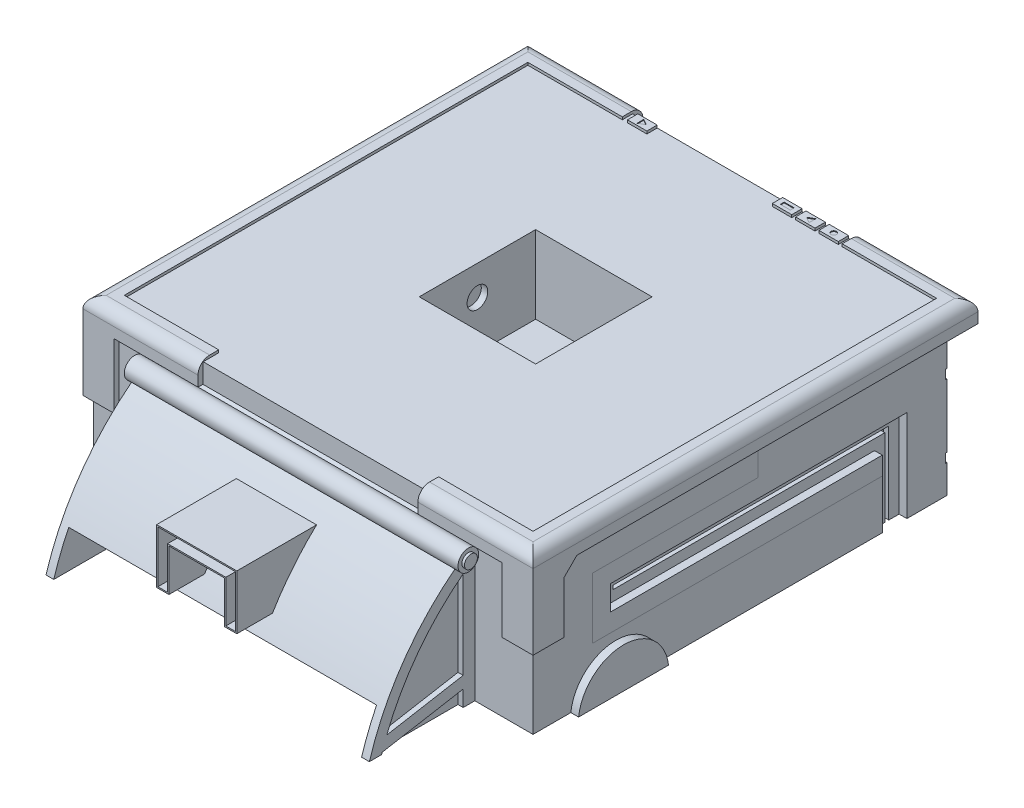
from build123d import *
from build123d.topology import SkipClean

# Parameters (mm, degrees)
SKETCH1_W                  = 340
SKETCH1_H                  = 344
BOSS_EXTRUDE1_DEPTH        = 209
SKETCH2_W                  = 340
SKETCH2_H                  = 344
BOSS_EXTRUDE3_DEPTH        = 133
SKETCH5_W                  = 340
SKETCH5_H                  = 107
CUT_EXTRUDE1_DEPTH         = 24
SKETCH6_W                  = 170
SKETCH6_H                  = 107
BOSS_EXTRUDE4_DEPTH        = 20
SKETCH7_W                  = 340
SKETCH7_H                  = 15
CUT_EXTRUDE2_DEPTH         = 4
CUT_EXTRUDE3_DEPTH         = 170
SKETCH9_W                  = 340
SKETCH9_H                  = 209
CUT_EXTRUDE4_DEPTH         = 4
FILLET1_R                  = 12
BOSS_EXTRUDE5_DEPTH        = 35
CUT_EXTRUDE5_DEPTH         = 8
CUT_EXTRUDE6_DEPTH         = 4
CUT_EXTRUDE9_DEPTH         = 5
SKETCH18_5_W               = 85
SKETCH18_5_H               = 107
BOSS_EXTRUDE6_DEPTH        = 0.8
BOSS_EXTRUDE7_DEPTH        = 170
BOSS_EXTRUDE9_DEPTH        = 107
SKETCH27_W                 = 85
SKETCH27_H                 = 107.8
SKETCH27_W_2               = 73
SKETCH27_H_2               = 50
BOSS_EXTRUDE11_DEPTH       = 0.8
SKETCH29_W                 = 85
SKETCH29_H                 = 102.8
SKETCH29_W_2               = 73
SKETCH29_H_2               = 50
CUT_EXTRUDE10_DEPTH        = 0.4
CUT_EXTRUDE11_DEPTH        = 0.6
CUT_EXTRUDE12_DEPTH        = 2
SKETCH33_W                 = 17
SKETCH33_H                 = 4
BOSS_EXTRUDE12_DEPTH       = 2
SKETCH34_W                 = 26
SKETCH34_H                 = 32
SKETCH34_W_2               = 22
SKETCH34_H_2               = 17
CUT_EXTRUDE13_DEPTH        = 0.4
SKETCH36_W                 = 22
SKETCH36_H                 = 17
CUT_EXTRUDE14_DEPTH        = 0.1
SKETCH37_R                 = 1.8
SKETCH37_R_2               = 1.5
CUT_EXTRUDE18_DEPTH        = 0.5
SKETCH40_R                 = 1.8
SKETCH40_R_2               = 1.5
CUT_EXTRUDE19_DEPTH        = 0.5
SKETCH41_W                 = 72
SKETCH41_H                 = 7
CUT_EXTRUDE20_DEPTH        = 1.2
BOSS_EXTRUDE13_DEPTH       = 8
EXTRUDE_THIN3_START        = -15
EXTRUDE_THIN3_DEPTH        = 15
BOSS_EXTRUDE14_DEPTH       = 2
BOSS_EXTRUDE15_DEPTH       = 50
MIRROR6_COPY_1_DEPTH       = 35
MIRROR6_COPY_2_DEPTH       = 4
MIRROR6_COPY_3_DEPTH       = 35
MIRROR6_COPY_4_DEPTH       = 4
CUT_EXTRUDE21_DEPTH        = 6
CUT_EXTRUDE22_DEPTH        = 4
BOSS_EXTRUDE16_DEPTH       = 6
SKETCH49_R                 = 35
BOSS_EXTRUDE17_DEPTH       = 6
SKETCH51_W                 = 15
SKETCH51_H                 = 8
BOSS_EXTRUDE18_DEPTH       = 2
SKETCH52_R                 = 2.134422377
SKETCH52_W                 = 7.700890096
SKETCH52_H                 = 2.996620518
CUT_EXTRUDE23_DEPTH        = 0.6
BOSS_EXTRUDE19_DEPTH       = 6
CUT_EXTRUDE24_DEPTH        = 4
BOSS_EXTRUDE20_START       = -250
SKETCH57_R                 = 8
BOSS_EXTRUDE20_DEPTH       = 250
BOSS_EXTRUDE21_DEPTH       = 4
SKETCH59_R                 = 5
BOSS_EXTRUDE22_DEPTH       = 2
BOSS_EXTRUDE23_DEPTH       = 238
SKETCH62_W                 = 90
SKETCH62_H                 = 90
CUT_EXTRUDE25_DEPTH        = 60
BOSS_EXTRUDE24_START       = -30
BOSS_EXTRUDE24_DEPTH       = 60
BOSS_EXTRUDE24_2_DEPTH     = 7.5
BOSS_EXTRUDE24_START_2     = 22.5
BOSS_EXTRUDE24_3_DEPTH     = 7.5
BOSS_EXTRUDE25_REACH       = 583.092
BOSS_EXTRUDE25_END_RADIUS  = 193.334535052
BOSS_EXTRUDE26_DEPTH       = 36
CUT_EXTRUDE26_DEPTH        = 238
SKETCH72_W                 = 138.7911761
SKETCH72_H                 = 200
BOSS_EXTRUDE27_DEPTH       = 36
SKETCH73_R                 = 8
BOSS_EXTRUDE28_DEPTH       = 6
SKETCH74_R                 = 12.5
SKETCH74_R_2               = 8
BOSS_EXTRUDE30_DEPTH       = 36
BOSS_EXTRUDE42_START       = -15
BOSS_EXTRUDE42_DEPTH       = 4
BOSS_EXTRUDE43_START       = 213.145262187
BOSS_EXTRUDE43_OUTLINE_W   = 4
BOSS_EXTRUDE43_OUTLINE_H   = 25
BOSS_EXTRUDE43_DEPTH       = 22
SKETCH76_W                 = 25
SKETCH76_H                 = 4
BOSS_EXTRUDE44_DEPTH       = 22
SKETCH77_R                 = 8.5
BOSS_EXTRUDE45_DEPTH       = 20
SKETCH78_R                 = 18
SKETCH78_R_2               = 8.5
BOSS_EXTRUDE48_DEPTH       = 30
SKETCH79_R                 = 16
BOSS_EXTRUDE49_DEPTH       = 65
SKETCH80_R                 = 8.5
BOSS_EXTRUDE51_DEPTH       = 9
BOSS_EXTRUDE53_START       = 11
BOSS_EXTRUDE53_DEPTH       = 4
BOSS_EXTRUDE56_START       = 213.145262187
BOSS_EXTRUDE56_OUTLINE_W   = 4
BOSS_EXTRUDE56_OUTLINE_H   = 25
BOSS_EXTRUDE56_DEPTH       = 22
SKETCH84_W                 = 25
SKETCH84_H                 = 4
BOSS_EXTRUDE57_DEPTH       = 22
MIRROR33_COPY_1_SKETCH_R   = 8
MIRROR33_COPY_1_DEPTH      = 6
MIRROR33_COPY_2_SKETCH_R   = 8
MIRROR33_COPY_2_DEPTH      = 6
MIRROR33_COPY_3_SKETCH_R   = 12.5
MIRROR33_COPY_3_SKETCH_R_2 = 8
MIRROR33_COPY_3_DEPTH      = 36
MIRROR33_COPY_4_SKETCH_R   = 12.5
MIRROR33_COPY_4_SKETCH_R_2 = 8
MIRROR33_COPY_4_DEPTH      = 36
SKETCH85_W                 = 4
SKETCH85_H                 = 202
CUT_EXTRUDE27_DEPTH        = 3
SKETCH86_R                 = 8
CUT_EXTRUDE28_DEPTH        = 5
FILLET2_R                  = 9
BOSS_EXTRUDE58_DEPTH       = 4
MIRROR37_COPY_1_SKETCH_R   = 8
MIRROR37_COPY_1_DEPTH      = 5
MIRROR37_COPY_2_SKETCH_R   = 8
MIRROR37_COPY_2_DEPTH      = 5
BOSS_EXTRUDE59_DEPTH       = 4
CUT_EXTRUDE29_DEPTH        = 40
SKETCH90_R                 = 10
CUT_EXTRUDE30_DEPTH        = 15
MIRROR39_COPY_1_SKETCH_R   = 10
MIRROR39_COPY_1_DEPTH      = 15
FILLET4_R                  = 12
SKETCH92_W                 = 364.21119794
SKETCH92_H                 = 456.773159848
CUT_EXTRUDE31_DEPTH        = 220
SKETCH93_W                 = 280
SKETCH93_H                 = 280
SKETCH93_W_2               = 260
SKETCH93_H_2               = 260
BOSS_EXTRUDE60_DEPTH       = 10
SKETCH94_R                 = 15
CUT_EXTRUDE32_DEPTH        = 62


with BuildPart() as part:
    # Sketch1 → Boss-Extrude1 (new body)
    with BuildSketch(Plane(origin=(0, 0, 0), x_dir=(1, 0, 0), z_dir=(0, 1, 0))):
        Rectangle(SKETCH1_W, SKETCH1_H)
    extrude(amount=BOSS_EXTRUDE1_DEPTH)

    # Sketch2 → Boss-Extrude3 (add)
    with BuildSketch(Plane(origin=(0, 209, 0), x_dir=(1, 0, 0), z_dir=(0, 1, 0))):
        Rectangle(SKETCH2_W, SKETCH2_H)
    extrude(amount=BOSS_EXTRUDE3_DEPTH)

    # Sketch5 → Cut-Extrude1 (cut)
    with BuildSketch(Plane(origin=(0, 0, -172), x_dir=(-1, 0, 0), z_dir=(0, 0, -1))):
        with Locations((0, 273.5)):
            Rectangle(SKETCH5_W, SKETCH5_H)
    extrude(amount=-CUT_EXTRUDE1_DEPTH, mode=Mode.SUBTRACT)

    # Sketch6 → Boss-Extrude4 (add)
    with BuildSketch(Plane(origin=(0, 0, -148), x_dir=(-1, 0, 0), z_dir=(0, 0, -1))):
        with Locations((0, 273.5)):
            Rectangle(SKETCH6_W, SKETCH6_H)
    extrude(amount=BOSS_EXTRUDE4_DEPTH)

    # Sketch7 → Cut-Extrude2 (cut)
    with BuildSketch(Plane(origin=(0, 0, -172), x_dir=(-1, 0, 0), z_dir=(0, 0, -1))):
        with Locations((0, 334.5)):
            Rectangle(SKETCH7_W, SKETCH7_H)
    extrude(amount=-CUT_EXTRUDE2_DEPTH, mode=Mode.SUBTRACT)

    # Sketch8 → Cut-Extrude3 (cut)
    with BuildSketch(Plane.ZY.offset(85)):
        Polygon((-168, 327), (-160, 342), (-168, 342), align=None)
    extrude(amount=-CUT_EXTRUDE3_DEPTH, mode=Mode.SUBTRACT)

    # Sketch9 → Cut-Extrude4 (cut)
    with BuildSketch(Plane(origin=(0, 0, -172), x_dir=(-1, 0, 0), z_dir=(0, 0, -1))):
        with Locations((0, 104.5)):
            Rectangle(SKETCH9_W, SKETCH9_H)
    extrude(amount=-CUT_EXTRUDE4_DEPTH, mode=Mode.SUBTRACT)

    # Fillet1
    fillet1_edges = [part.edges().sort_by_distance(p)[0] for p in [
        (-170, 104.5, -168),
        (170, 104.5, -168),
    ]]
    fillet(fillet1_edges, radius=FILLET1_R)

    # Sketch13 → Boss-Extrude5 (add)
    with BuildSketch(Plane(origin=(-158, 0, 0), x_dir=(0, 0, -1), z_dir=(1, 0, 0))):
        Polygon((172, 209), (167.854423693, 209), (168, 89), (172, 172), align=None)
    boss_extrude5 = extrude(amount=BOSS_EXTRUDE5_DEPTH)

    # Sketch14 → Cut-Extrude5 (cut)
    with BuildSketch(Plane(origin=(-84, 0, 0), x_dir=(0, 0, -1), z_dir=(1, 0, 0))):
        Polygon((168, 195), (164, 195), (164, 92), (168, 85), align=None)
    cut_extrude5 = extrude(amount=CUT_EXTRUDE5_DEPTH, mode=Mode.SUBTRACT)

    # Sketch16 → Cut-Extrude6 (cut)
    with BuildSketch(Plane(origin=(0, 0, 0), x_dir=(0, 0, -1), z_dir=(1, 0, 0))):
        Polygon((168, 195), (164, 195), (164, 92), (168, 85), align=None)
    cut_extrude6 = extrude(amount=-CUT_EXTRUDE6_DEPTH, mode=Mode.SUBTRACT)

    # Sketch18 → Cut-Extrude9 (cut)
    with BuildSketch(Plane(origin=(0, 0, -168), x_dir=(-1, 0, 0), z_dir=(0, 0, -1))):
        Polygon((4, 319.5), (4, 230), (12.5, 230), (12.5, 222.5), (72.5, 222.5), (72.5, 230), (81, 230), (81, 319.5), (72.5, 319.5), (72.5, 324.5), (12.5, 324.5), (12.5, 319.5), align=None)
    extrude(amount=-CUT_EXTRUDE9_DEPTH, mode=Mode.SUBTRACT)

    # Sketch18<5> → Boss-Extrude6 (add)
    with BuildSketch(Plane(origin=(0, 0, -168), x_dir=(-1, 0, 0), z_dir=(0, 0, -1))):
        with Locations((42.5, 273.5)):
            Rectangle(SKETCH18_5_W, SKETCH18_5_H)
        Polygon((4, 319.5), (4, 230), (12.5, 230), (12.5, 222.5), (72.5, 222.5), (72.5, 230), (81, 230), (81, 319.5), (72.5, 319.5), (72.5, 324.5), (12.5, 324.5), (12.5, 319.5), align=None, mode=Mode.SUBTRACT)
    extrude(amount=BOSS_EXTRUDE6_DEPTH)

    # Sketch22 → Boss-Extrude7 (add)
    with BuildSketch(Plane.ZY.offset(85)):
        Polygon((-168, 327), (-160, 342), (-168, 327.8), align=None)
    extrude(amount=-BOSS_EXTRUDE7_DEPTH)

    # Sketch25 → Boss-Extrude9 (add)
    with BuildSketch(Plane(origin=(0, 220, 0), x_dir=(1, 0, 0), z_dir=(0, 1, 0))):
        with BuildLine():
            Line((-85, 168.8), (-85, 148))
            Line((-85, 148), (-90, 148))
            Line((-90, 148), (-90, 163.8))
            ThreePointArc((-90, 163.8), (-88.535533906, 167.335533906), (-85, 168.8))
        make_face()
    boss_extrude9 = extrude(amount=BOSS_EXTRUDE9_DEPTH)

    # Mirror1: Boss-Extrude9 across plane
    add(boss_extrude9.mirror(Plane(origin=(0, 0, 0), x_dir=(0, 0, 1), z_dir=(1, 0, 0))))

    # Sketch27 → Boss-Extrude11 (add)
    with BuildSketch(Plane(origin=(0, 0, -168), x_dir=(-1, 0, 0), z_dir=(0, 0, -1))):
        with Locations((-42.5, 273.9)):
            Rectangle(SKETCH27_W, SKETCH27_H)
        with Locations((-42.5, 294.8)):
            Rectangle(SKETCH27_W_2, SKETCH27_H_2, mode=Mode.SUBTRACT)
    extrude(amount=BOSS_EXTRUDE11_DEPTH)

    # Sketch29 → Cut-Extrude10 (cut)
    with BuildSketch(Plane(origin=(0, 0, -168.8), x_dir=(-1, 0, 0), z_dir=(0, 0, -1))):
        with Locations((-40.5, 274.4)):
            Rectangle(SKETCH29_W, SKETCH29_H)
        with Locations((-42.5, 294.8)):
            Rectangle(SKETCH29_W_2, SKETCH29_H_2, mode=Mode.SUBTRACT)
    extrude(amount=-CUT_EXTRUDE10_DEPTH, mode=Mode.SUBTRACT)

    # Sketch31 → Cut-Extrude11 (cut)
    with BuildSketch(Plane(origin=(0, 0, -168), x_dir=(-1, 0, 0), z_dir=(0, 0, -1))):
        with BuildLine():
            Line((-62, 313.3), (-23, 313.3))
            ThreePointArc((-23, 313.3), (-16.636038969, 310.663961031), (-14, 304.3))
            Line((-14, 304.3), (-14, 285.3))
            ThreePointArc((-14, 285.3), (-16.636038969, 278.936038969), (-23, 276.3))
            Line((-23, 276.3), (-62, 276.3))
            ThreePointArc((-62, 276.3), (-68.363961031, 278.936038969), (-71, 285.3))
            Line((-71, 285.3), (-71, 304.3))
            ThreePointArc((-71, 304.3), (-68.363961031, 310.663961031), (-62, 313.3))
        make_face()
    extrude(amount=-CUT_EXTRUDE11_DEPTH, mode=Mode.SUBTRACT)

    # Sketch32 → Cut-Extrude12 (cut)
    with BuildSketch(Plane(origin=(0, 0, -167.4), x_dir=(-1, 0, 0), z_dir=(0, 0, -1))):
        Polygon((-53, 313.3), (-53, 304.3), (-71, 304.3), (-71, 302.3), (-53, 302.3), (-53, 298.3), (-71, 298.3), (-71, 296.3), (-53, 296.3), (-53, 292.3), (-71, 292.3), (-71, 290.3), (-53, 290.3), (-53, 286.3), (-71, 286.3), (-71, 284.3), (-53, 284.3), (-53, 276.3), (-51, 276.3), (-51, 284.3), (-34, 284.3), (-34, 276.3), (-32, 276.3), (-32, 284.3), (-14, 284.3), (-14, 286.3), (-32, 286.3), (-32, 290.3), (-14, 290.3), (-14, 292.3), (-32, 292.3), (-32, 296.3), (-14, 296.3), (-14, 298.3), (-32, 298.3), (-32, 302.3), (-14, 302.3), (-14, 304.3), (-32, 304.3), (-32, 313.3), (-34, 313.3), (-34, 304.3), (-51, 304.3), (-51, 313.3), align=None)
    extrude(amount=-CUT_EXTRUDE12_DEPTH, mode=Mode.SUBTRACT)

    # Sketch33 → Boss-Extrude12 (add)
    with BuildSketch(Plane(origin=(0, 0, -165.4), x_dir=(-1, 0, 0), z_dir=(0, 0, -1))):
        with Locations((-42.5, 294.3)):
            Rectangle(SKETCH33_W, SKETCH33_H)
        with Locations((-42.5, 300.3)):
            Rectangle(SKETCH33_W, SKETCH33_H)
        with Locations((-42.5, 288.3)):
            Rectangle(SKETCH33_W, SKETCH33_H)
    extrude(amount=BOSS_EXTRUDE12_DEPTH)

    # Sketch34 → Cut-Extrude13 (cut)
    with BuildSketch(Plane(origin=(0, 0, -168.4), x_dir=(-1, 0, 0), z_dir=(0, 0, -1))):
        with Locations((-62, 247)):
            Rectangle(SKETCH34_W, SKETCH34_H)
        with Locations((-62, 249.5)):
            Rectangle(SKETCH34_W_2, SKETCH34_H_2, mode=Mode.SUBTRACT)
    extrude(amount=-CUT_EXTRUDE13_DEPTH, mode=Mode.SUBTRACT)

    # Sketch36 → Cut-Extrude14 (cut)
    with BuildSketch(Plane(origin=(0, 0, -168.4), x_dir=(-1, 0, 0), z_dir=(0, 0, -1))):
        with Locations((-62, 249.5)):
            Rectangle(SKETCH36_W, SKETCH36_H)
    extrude(amount=-CUT_EXTRUDE14_DEPTH, mode=Mode.SUBTRACT)

    # Sketch37 → Cut-Extrude18 (cut)
    # profile 1 of 4: a face of its own
    with BuildSketch(Plane(origin=(0, 0, -168.4), x_dir=(-1, 0, 0), z_dir=(0, 0, -1))):
        with Locations((-0.6, 225.6)):
            Circle(SKETCH37_R)
        with Locations((-0.6, 225.6)):
            Circle(SKETCH37_R_2, mode=Mode.SUBTRACT)
    # profile 2 of 4: a face of its own
    with BuildSketch(Plane(origin=(0, 0, -168.4), x_dir=(-1, 0, 0), z_dir=(0, 0, -1))):
        with Locations((-80.4, 225.6)):
            Circle(SKETCH37_R)
        with Locations((-80.4, 225.6)):
            Circle(SKETCH37_R_2, mode=Mode.SUBTRACT)
    # profile 3 of 4: a face of its own
    with BuildSketch(Plane(origin=(0, 0, -168.4), x_dir=(-1, 0, 0), z_dir=(0, 0, -1))):
        with Locations((-80.4, 323.2)):
            Circle(SKETCH37_R)
        with Locations((-80.4, 323.2)):
            Circle(SKETCH37_R_2, mode=Mode.SUBTRACT)
    # profile 4 of 4: a face of its own
    with BuildSketch(Plane(origin=(0, 0, -168.4), x_dir=(-1, 0, 0), z_dir=(0, 0, -1))):
        with Locations((-0.6, 323.2)):
            Circle(SKETCH37_R)
        with Locations((-0.6, 323.2)):
            Circle(SKETCH37_R_2, mode=Mode.SUBTRACT)
    extrude(amount=-CUT_EXTRUDE18_DEPTH, mode=Mode.SUBTRACT)

    # Sketch40 → Cut-Extrude19 (cut)
    # profile 1 of 4: a face of its own
    with BuildSketch(Plane(origin=(0, 0, -168.8), x_dir=(-1, 0, 0), z_dir=(0, 0, -1))):
        with Locations((9.5, 322.5)):
            Circle(SKETCH40_R)
        with Locations((9.5, 322.5)):
            Circle(SKETCH40_R_2, mode=Mode.SUBTRACT)
    # profile 2 of 4: a face of its own
    with BuildSketch(Plane(origin=(0, 0, -168.8), x_dir=(-1, 0, 0), z_dir=(0, 0, -1))):
        with Locations(Location((75.5, 322.5, 0), (0, 0, 180))):
            Circle(SKETCH40_R)
        with Locations(Location((75.5, 322.5, 0), (0, 0, 180))):
            Circle(SKETCH40_R_2, mode=Mode.SUBTRACT)
    # profile 3 of 4: a face of its own
    with BuildSketch(Plane(origin=(0, 0, -168.8), x_dir=(-1, 0, 0), z_dir=(0, 0, -1))):
        with Locations((75.5, 227)):
            Circle(SKETCH40_R)
        with Locations((75.5, 227)):
            Circle(SKETCH40_R_2, mode=Mode.SUBTRACT)
    # profile 4 of 4: a face of its own
    with BuildSketch(Plane(origin=(0, 0, -168.8), x_dir=(-1, 0, 0), z_dir=(0, 0, -1))):
        with Locations(Location((9.5, 227, 0), (0, 0, 180))):
            Circle(SKETCH40_R)
        with Locations(Location((9.5, 227, 0), (0, 0, 180))):
            Circle(SKETCH40_R_2, mode=Mode.SUBTRACT)
    extrude(amount=-CUT_EXTRUDE19_DEPTH, mode=Mode.SUBTRACT)

    # Sketch41 → Cut-Extrude20 (cut)
    with BuildSketch(Plane(origin=(0, 0, -148), x_dir=(-1, 0, 0), z_dir=(0, 0, -1))):
        with Locations((134, 301.5)):
            Rectangle(SKETCH41_W, SKETCH41_H)
        with Locations((134, 245.5)):
            Rectangle(SKETCH41_W, SKETCH41_H)
    cut_extrude20 = extrude(amount=-CUT_EXTRUDE20_DEPTH, mode=Mode.SUBTRACT)

    # Sketch42 → Boss-Extrude13 (add)
    with BuildSketch(Plane.ZY.offset(90)):
        Polygon((-148, 327), (-148, 220), (-152, 220), (-152, 242), (-154.5, 242), (-154.5, 249), (-152, 249), (-152, 298), (-153.572455971, 298), (-153.572455971, 305), (-152, 305), (-152, 327), align=None)
    boss_extrude13 = extrude(amount=BOSS_EXTRUDE13_DEPTH)

    # Mirror2: Cut-Extrude20, Boss-Extrude13 across plane
    add(cut_extrude20.mirror(Plane(origin=(0, 0, 0), x_dir=(0, 0, 1), z_dir=(1, 0, 0))), mode=Mode.SUBTRACT)
    add(boss_extrude13.mirror(Plane(origin=(0, 0, 0), x_dir=(0, 0, 1), z_dir=(1, 0, 0))))

    # Sketch43 → Extrude-Thin3 (add)
    with BuildSketch(Plane(origin=(0, 342, 0), x_dir=(1, 0, 0), z_dir=(0, 1, 0)).offset(EXTRUDE_THIN3_START)):
        Polygon((-174, 168), (-174, -176), (-85, -176), (-85, -160), (-95, -160), (-95, -166), (-164, -166), (-164, 168), align=None)
    extrude_thin3 = extrude(amount=EXTRUDE_THIN3_DEPTH)

    # Mirror3: Extrude-Thin3 across plane
    add(extrude_thin3.mirror(Plane(origin=(0, 0, 0), x_dir=(0, 0, 1), z_dir=(1, 0, 0))))

    # Sketch43<6> → Boss-Extrude14 (add)
    with BuildSketch(Plane(origin=(0, 342, 0), x_dir=(1, 0, 0), z_dir=(0, 1, 0))):
        Polygon((85, 160), (85, 152), (158, 152), (158, -160), (85, -160), (85, -172), (170, -172), (170, 168), (85, 168), align=None)
        Polygon((170, -172), (85, -172), (85, -176), (174, -176), (174, 168), (170, 168), align=None)
        Polygon((-158, -160), (-158, 152), (-85, 152), (-85, 160), (-85, 168), (-170, 168), (-170, -172), (-85, -172), (-85, -160), align=None)
        Polygon((-85, -176), (-85, -172), (-170, -172), (-170, 168), (-174, 168), (-174, -176), align=None)
    extrude(amount=BOSS_EXTRUDE14_DEPTH)

    # Sketch44 → Boss-Extrude15 (add)
    with BuildSketch(Plane.XZ.offset(-327)):
        Polygon((-150, 176), (-174, 176), (-174, 152), (-170, 152), (-170, 172), (-150, 172), align=None)
    boss_extrude15 = extrude(amount=BOSS_EXTRUDE15_DEPTH)

    # Mirror4: Boss-Extrude15 across plane
    add(boss_extrude15.mirror(Plane(origin=(0, 0, 0), x_dir=(0, 0, 1), z_dir=(1, 0, 0))))

    # Mirror5: Boss-Extrude5, Cut-Extrude6 across plane
    add(boss_extrude5.mirror(Plane(origin=(0, 0, 0), x_dir=(0, 0, 1), z_dir=(1, 0, 0))))
    add(cut_extrude6.mirror(Plane(origin=(0, 0, 0), x_dir=(0, 0, 1), z_dir=(1, 0, 0))), mode=Mode.SUBTRACT)

    # Mirror6: Cut-Extrude5 across plane
    add(cut_extrude5.mirror(Plane(origin=(0, 0, 0), x_dir=(0, 0, 1), z_dir=(1, 0, 0))), mode=Mode.SUBTRACT)

    # Mirror6 copy 1 sketch → Mirror6 copy 1 (add)
    with BuildSketch(Plane(origin=(-158, 0, 0), x_dir=(0, 0, -1), z_dir=(1, 0, 0))):
        Polygon((172, 209), (167.854423693, 209), (168, 89), (172, 172), align=None)
    extrude(amount=MIRROR6_COPY_1_DEPTH)

    # Mirror6 copy 2 sketch → Mirror6 copy 2 (cut)
    with BuildSketch(Plane(origin=(0, 0, 0), x_dir=(0, 0, -1), z_dir=(1, 0, 0))):
        Polygon((168, 195), (164, 195), (164, 92), (168, 85), align=None)
    extrude(amount=-MIRROR6_COPY_2_DEPTH, mode=Mode.SUBTRACT)

    # Mirror6 copy 3 sketch → Mirror6 copy 3 (add)
    with BuildSketch(Plane(origin=(158, 0, 0), x_dir=(0, 0, -1), z_dir=(-1, 0, 0))):
        Polygon((172, -209), (167.854423693, -209), (168, -89), (172, -172), align=None)
    extrude(amount=MIRROR6_COPY_3_DEPTH)

    # Mirror6 copy 4 sketch → Mirror6 copy 4 (cut)
    with BuildSketch(Plane(origin=(0, 0, 0), x_dir=(0, 0, -1), z_dir=(-1, 0, 0))):
        Polygon((168, -195), (164, -195), (164, -92), (168, -85), align=None)
    extrude(amount=-MIRROR6_COPY_4_DEPTH, mode=Mode.SUBTRACT)

    # Sketch46 → Cut-Extrude21 (cut)
    with BuildSketch(Plane.ZY.offset(170)):
        Polygon((-117, 291), (112, 291), (112, 272), (-98, 272), (-98, 81), (91.671025307, 81), (91.671025307, 62), (-117, 62), align=None)
    cut_extrude21 = extrude(amount=-CUT_EXTRUDE21_DEPTH, mode=Mode.SUBTRACT)

    # Sketch47 → Cut-Extrude22 (cut)
    with BuildSketch(Plane.ZY.offset(164)):
        Polygon((-109, 283), (-109, 70), (83.671025307, 70), (83.671025307, 73), (-106, 73), (-106, 280), (104, 280), (104, 283), align=None)
    cut_extrude22 = extrude(amount=-CUT_EXTRUDE22_DEPTH, mode=Mode.SUBTRACT)

    # Sketch48 → Boss-Extrude16 (add)
    with BuildSketch(Plane.ZY.offset(170)):
        Polygon((-98, 81), (-98, 213), (172, 166), (172, 81), align=None)
    boss_extrude16 = extrude(amount=BOSS_EXTRUDE16_DEPTH)

    # Sketch49 → Boss-Extrude17 (add)
    with BuildSketch(Plane.ZY.offset(170)):
        with Locations(Location((108, 216, 0), (0, 0, 191.536959033))):
            Circle(SKETCH49_R)
    boss_extrude17 = extrude(amount=BOSS_EXTRUDE17_DEPTH)

    # Sketch51 → Boss-Extrude18 (add)
    with BuildSketch(Plane(origin=(0, 342, 0), x_dir=(1, 0, 0), z_dir=(0, 1, 0))):
        with Locations((-73.5, 156)):
            Rectangle(SKETCH51_W, SKETCH51_H)
        with Locations((74.5, 156)):
            Rectangle(SKETCH51_W, SKETCH51_H)
        with Locations((56.5, 156)):
            Rectangle(SKETCH51_W, SKETCH51_H)
        with Locations((38.5, 156)):
            Rectangle(SKETCH51_W, SKETCH51_H)
    extrude(amount=BOSS_EXTRUDE18_DEPTH)

    # Sketch52 → Cut-Extrude23 (cut)
    with BuildSketch(Plane(origin=(0, 344, 0), x_dir=(1, 0, 0), z_dir=(0, 1, 0))):
        with Locations(Location((74.5, 156, 0), (0, 0, 270))):
            Circle(SKETCH52_R)
        Polygon((53.437575423, 156), (58.031212288, 153.34786252), (58.031212288, 158.65213748), align=None)
        with Locations((38.5, 156)):
            Rectangle(SKETCH52_W, SKETCH52_H)
        Polygon((-70.500703421, 156), (-74.999648289, 158.597467031), (-74.999648289, 153.402532969), align=None)
    extrude(amount=-CUT_EXTRUDE23_DEPTH, mode=Mode.SUBTRACT)

    # Mirror7: Cut-Extrude21, Cut-Extrude22, Boss-Extrude16, Boss-Extrude17 across plane
    add(cut_extrude21.mirror(Plane(origin=(0, 0, 0), x_dir=(0, 0, 1), z_dir=(1, 0, 0))), mode=Mode.SUBTRACT)
    add(cut_extrude22.mirror(Plane(origin=(0, 0, 0), x_dir=(0, 0, 1), z_dir=(1, 0, 0))), mode=Mode.SUBTRACT)
    add(boss_extrude16.mirror(Plane(origin=(0, 0, 0), x_dir=(0, 0, 1), z_dir=(1, 0, 0))))
    add(boss_extrude17.mirror(Plane(origin=(0, 0, 0), x_dir=(0, 0, 1), z_dir=(1, 0, 0))))

    # Sketch55 → Boss-Extrude19 (add)
    with BuildSketch(Plane.ZY.offset(125)):
        with BuildLine():
            Line((172, 0), (172, 326.804016556))
            ThreePointArc((172, 326.804016556), (262, 163.402008278), (172, 0))
        make_face()
    boss_extrude19 = extrude(amount=-BOSS_EXTRUDE19_DEPTH)

    # Sketch56 → Cut-Extrude24 (cut)
    with BuildSketch(Plane.ZY.offset(125)):
        with BuildLine():
            Line((181, 241.553207546), (240.106366627, 231.131160378))
            ThreePointArc((240.106366627, 231.131160378), (215.871541567, 274.350608176), (181, 309.553207546))
            Line((181, 309.553207546), (181, 241.553207546))
        make_face()
        with BuildLine():
            Line((243.648898663, 221.367676893), (181, 232.414368039))
            Line((181, 232.414368039), (181, 209))
            Line((181, 209), (181, 89.25080901))
            Line((181, 89.25080901), (252.987298561, 161.238107571))
            ThreePointArc((252.987298561, 161.238107571), (250.816391543, 191.690888666), (243.648898663, 221.367676893))
        make_face()
        with BuildLine():
            Line((181, 80.576479256), (252.661628315, 152.238107571))
            ThreePointArc((252.661628315, 152.238107571), (231.47935686, 76.967886467), (181, 17.25080901))
            Line((181, 17.25080901), (181, 80.576479256))
        make_face()
    cut_extrude24 = extrude(amount=-CUT_EXTRUDE24_DEPTH, mode=Mode.SUBTRACT)

    # Mirror8: Boss-Extrude19, Cut-Extrude24 across plane
    add(boss_extrude19.mirror(Plane(origin=(0, 0, 0), x_dir=(0, 0, 1), z_dir=(1, 0, 0))))
    add(cut_extrude24.mirror(Plane(origin=(0, 0, 0), x_dir=(0, 0, 1), z_dir=(1, 0, 0))), mode=Mode.SUBTRACT)

    # Sketch57 → Boss-Extrude20 (add)
    with BuildSketch(Plane.ZY.offset(125).offset(BOSS_EXTRUDE20_START)):
        with Locations(Location((181, 320.752555397, 0), (0, 0, 323.290973946))):
            Circle(SKETCH57_R)
    extrude(amount=BOSS_EXTRUDE20_DEPTH)

    # Sketch58 → Boss-Extrude21 (add)
    with BuildSketch(Plane.ZY.offset(125)):
        with BuildLine():
            ThreePointArc((189, 320.752555397), (183.361529997, 328.39606088), (174.394205982, 325.265147267))
            ThreePointArc((174.394205982, 325.265147267), (176.351703304, 314.241538745), (187.413451902, 315.970543822))
            ThreePointArc((187.413451902, 315.970543822), (188.593010444, 318.233390378), (189, 320.752555397))
        make_face()
    boss_extrude21 = extrude(amount=BOSS_EXTRUDE21_DEPTH)

    # Sketch59 → Boss-Extrude22 (add)
    with BuildSketch(Plane.ZY.offset(129)):
        with Locations((181, 320.752555397)):
            Circle(SKETCH59_R)
    boss_extrude22 = extrude(amount=BOSS_EXTRUDE22_DEPTH)

    # Mirror9: Boss-Extrude21, Boss-Extrude22 across plane
    add(boss_extrude21.mirror(Plane(origin=(0, 0, 0), x_dir=(0, 0, 1), z_dir=(1, 0, 0))))
    add(boss_extrude22.mirror(Plane(origin=(0, 0, 0), x_dir=(0, 0, 1), z_dir=(1, 0, 0))))

    # Sketch61 → Boss-Extrude23 (add)
    with BuildSketch(Plane.ZY.offset(-119)):
        with BuildLine():
            Line((172, 326.804016556), (172, 232.208396297))
            Line((172, 232.208396297), (249.341759496, 232.208396297))
            ThreePointArc((249.341759496, 232.208396297), (218.340515226, 285.776931233), (172, 326.804016556))
        make_face()
    extrude(amount=BOSS_EXTRUDE23_DEPTH)

    # Sketch62 → Cut-Extrude25 (cut)
    with BuildSketch(Plane(origin=(0, 342, 0), x_dir=(1, 0, 0), z_dir=(0, 1, 0))):
        Rectangle(SKETCH62_W, SKETCH62_H)
    extrude(amount=-CUT_EXTRUDE25_DEPTH, mode=Mode.SUBTRACT)

    # Boss-Extrude24: read off the stored shape, not the designer's step
    # Boss-Extrude24 outline → Boss-Extrude24 (add)
    with BuildSketch(Plane.YZ.offset(BOSS_EXTRUDE24_START)):
        with BuildLine():
            Line((303.970543822, 201.401026343), (303.970543822, 207.162416319))
            ThreePointArc((303.970543822, 207.162416319), (300.268172507, 210.82232132), (296.470543822, 214.383286687))
            Line((296.470543822, 214.383286687), (296.470543822, 208.91883315))
            ThreePointArc((296.470543822, 208.91883315), (300.272169464, 205.211433107), (303.970543822, 201.401026343))
        make_face()
    extrude(amount=BOSS_EXTRUDE24_DEPTH)

    # Boss-Extrude24 2 outline → Boss-Extrude24 2 (add)
    with BuildSketch(Plane.YZ.offset(BOSS_EXTRUDE24_START)):
        with BuildLine():
            Line((296.470543822, 208.91883315), (296.470543822, 214.383286687))
            ThreePointArc((296.470543822, 214.383286687), (280.796665928, 227.282655314), (263.880543822, 238.503572036))
            Line((263.880543822, 238.503572036), (263.880543822, 233.839029233))
            ThreePointArc((263.880543822, 233.839029233), (280.83842787, 222.245834127), (296.470543822, 208.91883315))
        make_face()
    extrude(amount=BOSS_EXTRUDE24_2_DEPTH)

    # Boss-Extrude24 3 outline → Boss-Extrude24 3 (add)
    with BuildSketch(Plane.YZ.offset(BOSS_EXTRUDE24_START_2)):
        with BuildLine():
            Line((296.470543822, 208.91883315), (296.470543822, 214.383286687))
            ThreePointArc((296.470543822, 214.383286687), (280.796665928, 227.282655314), (263.880543822, 238.503572036))
            Line((263.880543822, 238.503572036), (263.880543822, 233.839029233))
            ThreePointArc((263.880543822, 233.839029233), (280.83842787, 222.245834127), (296.470543822, 208.91883315))
        make_face()
    extrude(amount=BOSS_EXTRUDE24_3_DEPTH)

    # Boss-Extrude25: up to this cylinder (the profile starts outside it)
    boss_extrude25_end = Plane(origin=(30.250629, 163.402008278, 68.665464948), z_dir=(-1, 0, 0)) * Cylinder(BOSS_EXTRUDE25_END_RADIUS, 1553.853070104, mode=Mode.PRIVATE)
    # Sketch64 → Boss-Extrude25 (add, up to the surface)
    with BuildSketch(Plane.XY.offset(262), mode=Mode.PRIVATE) as boss_extrude25_sk1:
        Polygon((31, 262.880543822), (31, 304.970543822), (-31, 304.970543822), (-31, 262.880543822), (-21.5, 262.880543822), (-21.5, 295.470543822), (21.5, 295.470543822), (21.5, 262.880543822), align=None)
        Polygon((-30, 303.970543822), (-30, 263.880543822), (-22.5, 263.880543822), (-22.5, 296.470543822), (22.5, 296.470543822), (22.5, 263.880543822), (30, 263.880543822), (30, 303.970543822), align=None, mode=Mode.SUBTRACT)
    boss_extrude25_tool1 = extrude(boss_extrude25_sk1.sketch, amount=-BOSS_EXTRUDE25_REACH, mode=Mode.PRIVATE) - boss_extrude25_end
    add(boss_extrude25_tool1.solids().sort_by_distance((30.250629, 283.925544, 262))[0])

    # Sketch65 → Boss-Extrude26 (add)
    with BuildSketch(Plane.XY.offset(172)):
        Polygon((69, 55), (119, 55), (119, 42), (-119, 42), (-119, 55), (-69, 55), (-69, 255), (69, 255), align=None)
    extrude(amount=BOSS_EXTRUDE26_DEPTH)

    # Sketch71 → Cut-Extrude26 (cut)
    with BuildSketch(Plane.ZY.offset(-119)):
        with BuildLine():
            Line((249.341759496, 232.208396297), (172, 232.208396297))
            Line((172, 232.208396297), (172, 249.145262187))
            Line((172, 249.145262187), (241.946556972, 249.145262187))
            ThreePointArc((241.946556972, 249.145262187), (245.84664971, 240.765243798), (249.341759496, 232.208396297))
        make_face()
    extrude(amount=CUT_EXTRUDE26_DEPTH, mode=Mode.SUBTRACT)

    # Sketch72 → Boss-Extrude27 (add)
    with BuildSketch(Plane.XY.offset(172)):
        with Locations((0.39558805, 155)):
            Rectangle(SKETCH72_W, SKETCH72_H)
    extrude(amount=BOSS_EXTRUDE27_DEPTH)

    # Sketch73 → Boss-Extrude28 (add)
    with BuildSketch(Plane(origin=(-119, 0, 0), x_dir=(0, 0, -1), z_dir=(1, 0, 0))):
        with Locations(Location((-192, 235.145262187, 0), (0, 0, 180))):
            Circle(SKETCH73_R)
    boss_extrude28 = extrude(amount=BOSS_EXTRUDE28_DEPTH)

    # Sketch74 → Boss-Extrude30 (add)
    # profile 1 of 3: a face of its own
    with BuildSketch(Plane(origin=(-113, 0, 0), x_dir=(0, 0, -1), z_dir=(1, 0, 0))):
        with Locations((-192, 235.145262187)):
            Circle(SKETCH74_R)
        with Locations(Location((-192, 235.145262187, 0), (0, 0, 180))):
            Circle(SKETCH74_R_2, mode=Mode.SUBTRACT)
    # profile 2 of 3: a face of its own
    with BuildSketch(Plane(origin=(-113, 0, 0), x_dir=(0, 0, -1), z_dir=(1, 0, 0))):
        with Locations(Location((-192, 235.145262187, 0), (0, 0, 180))):
            Circle(SKETCH74_R_2)
    # profile 3 of 3: a face of its own
    with BuildSketch(Plane(origin=(-113, 0, 0), x_dir=(0, 0, -1), z_dir=(1, 0, 0))):
        with Locations(Location((-192, 235.145262187, 0), (0, 0, 180))):
            Circle(SKETCH74_R_2)
    boss_extrude30 = extrude(amount=BOSS_EXTRUDE30_DEPTH)

    # Sketch75 → Boss-Extrude42 (add)
    with BuildSketch(Plane(origin=(-95, 0, 0), x_dir=(0, 0, -1), z_dir=(1, 0, 0)).offset(BOSS_EXTRUDE42_START)):
        with BuildLine():
            Line((-179.5, 235.145262187), (-179.5, 213.145262187))
            Line((-179.5, 213.145262187), (-204.5, 213.145262187))
            Line((-204.5, 213.145262187), (-204.5, 235.145262187))
            ThreePointArc((-204.5, 235.145262187), (-192, 247.645262187), (-179.5, 235.145262187))
        make_face()
    boss_extrude42 = extrude(amount=BOSS_EXTRUDE42_DEPTH)

    # Boss-Extrude43: read off the stored shape, not the designer's step
    # Boss-Extrude43 outline → Boss-Extrude43 (add)
    with BuildSketch(Plane(origin=(0, 0, 0), x_dir=(1, 0, 0), z_dir=(0, 1, 0)).offset(BOSS_EXTRUDE43_START)):
        with Locations((-82, -192)):
            Rectangle(BOSS_EXTRUDE43_OUTLINE_W, BOSS_EXTRUDE43_OUTLINE_H)
    boss_extrude43 = extrude(amount=BOSS_EXTRUDE43_DEPTH)

    # Sketch76 → Boss-Extrude44 (add)
    with BuildSketch(Plane.ZY.offset(84)):
        with Locations((192, 215.145262187)):
            Rectangle(SKETCH76_W, SKETCH76_H)
    boss_extrude44 = extrude(amount=BOSS_EXTRUDE44_DEPTH)

    # Sketch77 → Boss-Extrude45 (add)
    with BuildSketch(Plane.XZ.offset(-213.145262187)):
        with Locations(Location((-95, 192, 0), (0, 0, 270))):
            Circle(SKETCH77_R)
    boss_extrude45 = extrude(amount=BOSS_EXTRUDE45_DEPTH)

    # Sketch78 → Boss-Extrude48 (add)
    # profile 1 of 2: a face of its own
    with SkipClean():  # the faces are left unmerged after this step: merging them gives an invalid solid
        with BuildSketch(Plane.XZ.offset(-193.145262187)):
            with Locations(Location((-95, 192, 0), (0, 0, 270))):
                Circle(SKETCH78_R)
            with Locations(Location((-95, 192, 0), (0, 0, 270))):
                Circle(SKETCH78_R_2, mode=Mode.SUBTRACT)
        # profile 2 of 2: a face of its own
        with BuildSketch(Plane.XZ.offset(-193.145262187)):
            with Locations(Location((-95, 192, 0), (0, 0, 270))):
                Circle(SKETCH78_R_2)
        boss_extrude48 = extrude(amount=BOSS_EXTRUDE48_DEPTH)

    # Sketch79 → Boss-Extrude49 (add)
    with SkipClean():  # the faces are left unmerged after this step: merging them gives an invalid solid
        with BuildSketch(Plane.XZ.offset(-163.145262187)):
            with Locations(Location((-95, 192, 0), (0, 0, 270))):
                Circle(SKETCH79_R)
        boss_extrude49 = extrude(amount=BOSS_EXTRUDE49_DEPTH)

    # Sketch80 → Boss-Extrude51 (add)
    with SkipClean():  # the faces are left unmerged after this step: merging them gives an invalid solid
        with BuildSketch(Plane.XZ.offset(-98.145262187)):
            with Locations(Location((-95, 192, 0), (0, 0, 270))):
                Circle(SKETCH80_R)
        boss_extrude51 = extrude(amount=BOSS_EXTRUDE51_DEPTH)

    # Mirror11: Boss-Extrude28, Boss-Extrude30, Boss-Extrude42, Boss-Extrude43, Boss-Extrude44 across plane
    with SkipClean():  # the faces are left unmerged after this step: merging them gives an invalid solid
        add(boss_extrude28.mirror(Plane(origin=(0, 152.145262187, 0), x_dir=(0, 0, 1), z_dir=(0, -1, 0))))
        add(boss_extrude30.mirror(Plane(origin=(0, 152.145262187, 0), x_dir=(0, 0, 1), z_dir=(0, -1, 0))))
        add(boss_extrude42.mirror(Plane(origin=(0, 152.145262187, 0), x_dir=(0, 0, 1), z_dir=(0, -1, 0))))
        add(boss_extrude43.mirror(Plane(origin=(0, 152.145262187, 0), x_dir=(0, 0, 1), z_dir=(0, -1, 0))))
        add(boss_extrude44.mirror(Plane(origin=(0, 152.145262187, 0), x_dir=(0, 0, 1), z_dir=(0, -1, 0))))

    # Mirror20: Boss-Extrude28 across plane
    add(boss_extrude28.mirror(Plane(origin=(0, 0, 0), x_dir=(0, 0, 1), z_dir=(1, 0, 0))))

    # Mirror21: Boss-Extrude30 across plane
    add(boss_extrude30.mirror(Plane(origin=(0, 0, 0), x_dir=(0, 0, 1), z_dir=(1, 0, 0))))

    # Sketch83 → Boss-Extrude53 (add)
    with BuildSketch(Plane(origin=(95, 0, 0), x_dir=(0, 0, -1), z_dir=(1, 0, 0)).offset(BOSS_EXTRUDE53_START)):
        with BuildLine():
            Line((-204.5, 235.145262187), (-204.5, 213.145262187))
            Line((-204.5, 213.145262187), (-179.5, 213.145262187))
            Line((-179.5, 213.145262187), (-179.5, 235.145262187))
            ThreePointArc((-179.5, 235.145262187), (-192, 247.645262187), (-204.5, 235.145262187))
        make_face()
    boss_extrude53 = extrude(amount=BOSS_EXTRUDE53_DEPTH)

    # Boss-Extrude56: read off the stored shape, not the designer's step
    # Boss-Extrude56 outline → Boss-Extrude56 (add)
    with BuildSketch(Plane(origin=(0, 0, 0), x_dir=(1, 0, 0), z_dir=(0, 1, 0)).offset(BOSS_EXTRUDE56_START)):
        with Locations((82, -192)):
            Rectangle(BOSS_EXTRUDE56_OUTLINE_W, BOSS_EXTRUDE56_OUTLINE_H)
    boss_extrude56 = extrude(amount=BOSS_EXTRUDE56_DEPTH)

    # Sketch84 → Boss-Extrude57 (add)
    with BuildSketch(Plane(origin=(84, 0, 0), x_dir=(0, 0, -1), z_dir=(1, 0, 0))):
        with Locations((-192, 215.145262187)):
            Rectangle(SKETCH84_W, SKETCH84_H)
    boss_extrude57 = extrude(amount=BOSS_EXTRUDE57_DEPTH)

    # Mirror32: Boss-Extrude45, Boss-Extrude48, Boss-Extrude49, Boss-Extrude51 across plane
    add(boss_extrude45.mirror(Plane(origin=(0, 0, 0), x_dir=(0, 0, 1), z_dir=(1, 0, 0))))
    add(boss_extrude48.mirror(Plane(origin=(0, 0, 0), x_dir=(0, 0, 1), z_dir=(1, 0, 0))))
    add(boss_extrude49.mirror(Plane(origin=(0, 0, 0), x_dir=(0, 0, 1), z_dir=(1, 0, 0))))
    add(boss_extrude51.mirror(Plane(origin=(0, 0, 0), x_dir=(0, 0, 1), z_dir=(1, 0, 0))))

    # Mirror33: Boss-Extrude53, Boss-Extrude57 across plane
    add(boss_extrude53.mirror(Plane(origin=(0, 152.145262187, 0), x_dir=(0, 0, 1), z_dir=(0, -1, 0))))
    add(boss_extrude57.mirror(Plane(origin=(0, 152.145262187, 0), x_dir=(0, 0, 1), z_dir=(0, -1, 0))))

    # Mirror33 copy 1 sketch → Mirror33 copy 1 (add)
    with BuildSketch(Plane(origin=(119, 304.290524373, 0), x_dir=(0, 0, -1), z_dir=(-1, 0, 0))):
        with Locations(Location((-192, 235.145262187, 0), (0, 0, 180))):
            Circle(MIRROR33_COPY_1_SKETCH_R)
    extrude(amount=MIRROR33_COPY_1_DEPTH)

    # Mirror33 copy 2 sketch → Mirror33 copy 2 (add)
    with BuildSketch(Plane(origin=(-119, 304.290524373, 0), x_dir=(0, 0, -1), z_dir=(1, 0, 0))):
        with Locations((-192, -235.145262187)):
            Circle(MIRROR33_COPY_2_SKETCH_R)
    extrude(amount=MIRROR33_COPY_2_DEPTH)

    # Mirror33 copy 3 sketch → Mirror33 copy 3 (add)
    # profile 1 of 3: a face of its own
    with BuildSketch(Plane(origin=(113, 304.290524373, 0), x_dir=(0, 0, -1), z_dir=(-1, 0, 0))):
        with Locations((-192, 235.145262187)):
            Circle(MIRROR33_COPY_3_SKETCH_R)
        with Locations(Location((-192, 235.145262187, 0), (0, 0, 180))):
            Circle(MIRROR33_COPY_3_SKETCH_R_2, mode=Mode.SUBTRACT)
    # profile 2 of 3: a face of its own
    with BuildSketch(Plane(origin=(113, 304.290524373, 0), x_dir=(0, 0, -1), z_dir=(-1, 0, 0))):
        with Locations(Location((-192, 235.145262187, 0), (0, 0, 180))):
            Circle(MIRROR33_COPY_3_SKETCH_R_2)
    # profile 3 of 3: a face of its own
    with BuildSketch(Plane(origin=(113, 304.290524373, 0), x_dir=(0, 0, -1), z_dir=(-1, 0, 0))):
        with Locations(Location((-192, 235.145262187, 0), (0, 0, 180))):
            Circle(MIRROR33_COPY_3_SKETCH_R_2)
    extrude(amount=MIRROR33_COPY_3_DEPTH)

    # Mirror33 copy 4 sketch → Mirror33 copy 4 (add)
    # profile 1 of 3: a face of its own
    with BuildSketch(Plane(origin=(-113, 304.290524373, 0), x_dir=(0, 0, -1), z_dir=(1, 0, 0))):
        with Locations((-192, -235.145262187)):
            Circle(MIRROR33_COPY_4_SKETCH_R)
        with Locations((-192, -235.145262187)):
            Circle(MIRROR33_COPY_4_SKETCH_R_2, mode=Mode.SUBTRACT)
    # profile 2 of 3: a face of its own
    with BuildSketch(Plane(origin=(-113, 304.290524373, 0), x_dir=(0, 0, -1), z_dir=(1, 0, 0))):
        with Locations((-192, -235.145262187)):
            Circle(MIRROR33_COPY_4_SKETCH_R_2)
    # profile 3 of 3: a face of its own
    with BuildSketch(Plane(origin=(-113, 304.290524373, 0), x_dir=(0, 0, -1), z_dir=(1, 0, 0))):
        with Locations((-192, -235.145262187)):
            Circle(MIRROR33_COPY_4_SKETCH_R_2)
    extrude(amount=MIRROR33_COPY_4_DEPTH)

    # Mirror34: Boss-Extrude53 across plane
    add(boss_extrude53.mirror(Plane(origin=(0, 152.145262187, 0), x_dir=(0, 0, 1), z_dir=(0, -1, 0))))

    # Mirror35: Boss-Extrude56 across plane
    add(boss_extrude56.mirror(Plane(origin=(0, 152.145262187, 0), x_dir=(0, 0, 1), z_dir=(0, -1, 0))))

    # Sketch85 → Cut-Extrude27 (cut)
    with BuildSketch(Plane.XY.offset(208)):
        with Locations((-54.093169514, 156)):
            Rectangle(SKETCH85_W, SKETCH85_H)
        with Locations((-17.093169514, 156)):
            Rectangle(SKETCH85_W, SKETCH85_H)
        with Locations((19.906830486, 156)):
            Rectangle(SKETCH85_W, SKETCH85_H)
        with Locations((56.906830486, 156)):
            Rectangle(SKETCH85_W, SKETCH85_H)
    extrude(amount=-CUT_EXTRUDE27_DEPTH, mode=Mode.SUBTRACT)

    # Sketch86 → Cut-Extrude28 (cut)
    with BuildSketch(Plane.ZY.offset(-45)):
        with Locations((0, 319)):
            Circle(SKETCH86_R)
    cut_extrude28 = extrude(amount=-CUT_EXTRUDE28_DEPTH, mode=Mode.SUBTRACT)

    # Fillet2
    fillet2_edges = [part.edges().sort_by_distance(p)[0] for p in [
        (174, 344, 4),
        (129.5, 344, 176),
        (129.5, 344, -168),
        (-129.5, 344, 176),
        (-129.5, 344, -168),
        (-174, 344, 4),
    ]]
    fillet(fillet2_edges, radius=FILLET2_R)

    # Sketch87 → Boss-Extrude58 (add)
    with BuildSketch(Plane(origin=(170, 0, 0), x_dir=(0, 0, -1), z_dir=(1, 0, 0))):
        Polygon((-152, 327), (-152, 317.100505063), (-142.100505063, 327), align=None)
    extrude(amount=BOSS_EXTRUDE58_DEPTH)

    # Mirror36: Cut-Extrude28 across plane
    add(cut_extrude28.mirror(Plane(origin=(0, 0, 0), x_dir=(0, 0, 1), z_dir=(1, 0, 0))), mode=Mode.SUBTRACT)

    # Mirror37 copy 1 sketch → Mirror37 copy 1 (cut)
    with BuildSketch(Plane.ZY.offset(-45)):
        with Locations((0, 319)):
            Circle(MIRROR37_COPY_1_SKETCH_R)
    extrude(amount=-MIRROR37_COPY_1_DEPTH, mode=Mode.SUBTRACT)

    # Mirror37 copy 2 sketch → Mirror37 copy 2 (cut)
    with BuildSketch(Plane(origin=(-45, 0, 0), x_dir=(0, 0, 1), z_dir=(1, 0, 0))):
        with Locations((0, -319)):
            Circle(MIRROR37_COPY_2_SKETCH_R)
    extrude(amount=-MIRROR37_COPY_2_DEPTH, mode=Mode.SUBTRACT)

    # Sketch88 → Boss-Extrude59 (add)
    with BuildSketch(Plane.ZY.offset(170)):
        Polygon((152, 327), (152, 317.100505063), (142.100505063, 327), align=None)
    extrude(amount=BOSS_EXTRUDE59_DEPTH)

    # Sketch89 → Cut-Extrude29 (cut)
    with BuildSketch(Plane.XZ):
        Polygon((100, 139), (-100, 139), (-100, 15), (-140, 15), (-140, -15), (-100, -15), (-100, -139), (100, -139), (100, -15), (140, -15), (140, 15), (100, 15), align=None)
    extrude(amount=-CUT_EXTRUDE29_DEPTH, mode=Mode.SUBTRACT)

    # Sketch90 → Cut-Extrude30 (cut)
    with BuildSketch(Plane.XY.offset(-15)):
        with Locations((-120, 20)):
            Circle(SKETCH90_R)
    cut_extrude30 = extrude(amount=-CUT_EXTRUDE30_DEPTH, mode=Mode.SUBTRACT)

    # Mirror38: Cut-Extrude30 across plane
    add(cut_extrude30.mirror(Plane.XY), mode=Mode.SUBTRACT)

    # Mirror39: Cut-Extrude30 across plane
    add(cut_extrude30.mirror(Plane(origin=(0, 0, 0), x_dir=(0, 0, 1), z_dir=(1, 0, 0))), mode=Mode.SUBTRACT)

    # Mirror39 copy 1 sketch → Mirror39 copy 1 (cut)
    with BuildSketch(Plane(origin=(0, 0, 15), x_dir=(-1, 0, 0), z_dir=(0, 0, -1))):
        with Locations((-120, 20)):
            Circle(MIRROR39_COPY_1_SKETCH_R)
    extrude(amount=-MIRROR39_COPY_1_DEPTH, mode=Mode.SUBTRACT)

    # Fillet4
    fillet4_edges = [part.edges().sort_by_distance(p)[0] for p in [
        (-170, 40.5, 172),
        (170, 40.5, 172),
    ]]
    fillet(fillet4_edges, radius=FILLET4_R)

    # Sketch92 → Cut-Extrude31 (cut)
    with BuildSketch(Plane(origin=(0, 220, 0), x_dir=(1, 0, 0), z_dir=(0, 1, 0))):
        with Locations((0, -47.012216563)):
            Rectangle(SKETCH92_W, SKETCH92_H)
    extrude(amount=-CUT_EXTRUDE31_DEPTH, mode=Mode.SUBTRACT)

    # Sketch93 → Boss-Extrude60 (add)
    with BuildSketch(Plane.XZ.offset(-220)):
        Rectangle(SKETCH93_W, SKETCH93_H)
        Rectangle(SKETCH93_W_2, SKETCH93_H_2, mode=Mode.SUBTRACT)
    extrude(amount=BOSS_EXTRUDE60_DEPTH)

    # Sketch94 → Cut-Extrude32 (cut)
    with BuildSketch(Plane(origin=(0, 282, 0), x_dir=(1, 0, 0), z_dir=(0, 1, 0))):
        with Locations(Location((0, 0, 0), (0, 0, 270))):
            Circle(SKETCH94_R)
    extrude(amount=-CUT_EXTRUDE32_DEPTH, mode=Mode.SUBTRACT)


solid = part.part
